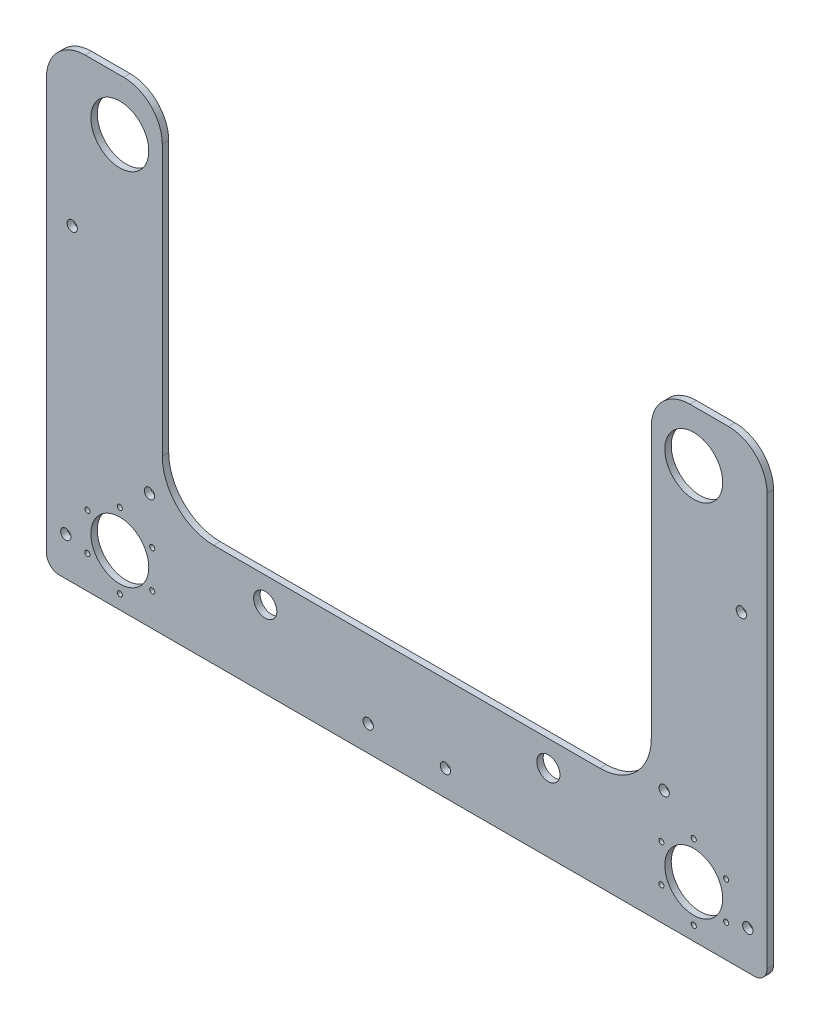
from build123d import *

# Parameters (mm, degrees)
SKETCH1_R           = 14.2875
SKETCH1_R_2         = 1.27
SKETCH1_R_3         = 5.715
SKETCH1_R_4         = 2.54
BOSS_EXTRUDE3_DEPTH = 3.175
SKETCH2_W           = 355.6
SKETCH2_H           = 19.05
CUT_EXTRUDE1_DEPTH  = 290.621961572
FILLET1_R           = 19.05


with BuildPart() as part:
    # Sketch1 → Boss-Extrude3 (new body)
    with BuildSketch(Plane.XY):
        with BuildLine():
            Line((120.65, -152.4), (120.65, -6.35))
            Line((120.65, -6.35), (120.65, 6.35))
            ThreePointArc((120.65, 6.35), (124.369743879, 15.330256121), (133.35, 19.05))
            Line((133.35, 19.05), (165.1, 19.05))
            ThreePointArc((165.1, 19.05), (174.080256121, 15.330256121), (177.8, 6.35))
            Line((177.8, 6.35), (177.8, -6.35))
            Line((177.8, -6.35), (177.8, -222.25))
            ThreePointArc((177.8, -222.25), (175.940128061, -226.740128061), (171.45, -228.6))
            Line((171.45, -228.6), (12.7, -228.6))
            Line((12.7, -228.6), (-12.7, -228.6))
            Line((-12.7, -228.6), (-171.45, -228.6))
            ThreePointArc((-171.45, -228.6), (-175.940128061, -226.740128061), (-177.8, -222.25))
            Line((-177.8, -222.25), (-177.8, -6.35))
            Line((-177.8, -6.35), (-177.8, 6.35))
            ThreePointArc((-177.8, 6.35), (-174.080256121, 15.330256121), (-165.1, 19.05))
            Line((-165.1, 19.05), (-133.35, 19.05))
            ThreePointArc((-133.35, 19.05), (-124.369743879, 15.330256121), (-120.65, 6.35))
            Line((-120.65, 6.35), (-120.65, -6.35))
            Line((-120.65, -6.35), (-120.65, -152.4))
            ThreePointArc((-120.65, -152.4), (-113.210512242, -170.360512242), (-95.25, -177.8))
            Line((-95.25, -177.8), (-12.7, -177.8))
            Line((-12.7, -177.8), (12.7, -177.8))
            Line((12.7, -177.8), (95.25, -177.8))
            ThreePointArc((95.25, -177.8), (113.210512242, -170.360512242), (120.65, -152.4))
        make_face()
        with Locations((141.605, -25.4)):
            Circle(SKETCH1_R, mode=Mode.SUBTRACT)
        with Locations((-141.605, -25.4)):
            Circle(SKETCH1_R, mode=Mode.SUBTRACT)
        with Locations((-141.605, -203.2)):
            Circle(SKETCH1_R, mode=Mode.SUBTRACT)
        with Locations((-141.605, -184.722481985)):
            Circle(SKETCH1_R_2, mode=Mode.SUBTRACT)
        with Locations((-125.603, -193.961240992)):
            Circle(SKETCH1_R_2, mode=Mode.SUBTRACT)
        with Locations((-125.603, -212.438759008)):
            Circle(SKETCH1_R_2, mode=Mode.SUBTRACT)
        with Locations((-141.605, -221.677518015)):
            Circle(SKETCH1_R_2, mode=Mode.SUBTRACT)
        with Locations((-157.607, -212.438759008)):
            Circle(SKETCH1_R_2, mode=Mode.SUBTRACT)
        with Locations((-157.607, -193.961240992)):
            Circle(SKETCH1_R_2, mode=Mode.SUBTRACT)
        with Locations((157.607, -212.438759008)):
            Circle(SKETCH1_R_2, mode=Mode.SUBTRACT)
        with Locations((157.607, -193.961240992)):
            Circle(SKETCH1_R_2, mode=Mode.SUBTRACT)
        with Locations((141.605, -184.722481985)):
            Circle(SKETCH1_R_2, mode=Mode.SUBTRACT)
        with Locations((125.603, -193.961240992)):
            Circle(SKETCH1_R_2, mode=Mode.SUBTRACT)
        with Locations((125.603, -212.438759008)):
            Circle(SKETCH1_R_2, mode=Mode.SUBTRACT)
        with Locations((141.605, -221.677518015)):
            Circle(SKETCH1_R_2, mode=Mode.SUBTRACT)
        with Locations((141.605, -203.2)):
            Circle(SKETCH1_R, mode=Mode.SUBTRACT)
        with Locations((-69.85, -190.5)):
            Circle(SKETCH1_R_3, mode=Mode.SUBTRACT)
        with Locations((69.85, -190.5)):
            Circle(SKETCH1_R_3, mode=Mode.SUBTRACT)
        with Locations((-19.05, -215.9)):
            Circle(SKETCH1_R_4, mode=Mode.SUBTRACT)
        with Locations((-127, -171.45)):
            Circle(SKETCH1_R_4, mode=Mode.SUBTRACT)
        with Locations((-149.225, 6.35)):
            Circle(SKETCH1_R_4, mode=Mode.SUBTRACT)
        with Locations((127, -171.45)):
            Circle(SKETCH1_R_4, mode=Mode.SUBTRACT)
        with Locations((149.225, 6.35)):
            Circle(SKETCH1_R_4, mode=Mode.SUBTRACT)
        with Locations((-168.275, -209.55)):
            Circle(SKETCH1_R_4, mode=Mode.SUBTRACT)
        with Locations((168.275, -209.55)):
            Circle(SKETCH1_R_4, mode=Mode.SUBTRACT)
        with Locations((-165.1, -76.2)):
            Circle(SKETCH1_R_4, mode=Mode.SUBTRACT)
        with Locations((165.1, -76.2)):
            Circle(SKETCH1_R_4, mode=Mode.SUBTRACT)
        with Locations((19.05, -215.9)):
            Circle(SKETCH1_R_4, mode=Mode.SUBTRACT)
    extrude(amount=BOSS_EXTRUDE3_DEPTH)

    # Sketch2 → Cut-Extrude1 (cut, through all)
    with BuildSketch(Plane.XY.offset(3.175)):
        with Locations((0, 9.525)):
            Rectangle(SKETCH2_W, SKETCH2_H)
    extrude(amount=-CUT_EXTRUDE1_DEPTH, mode=Mode.SUBTRACT)

    # Fillet1
    fillet1_edges = [part.edges().sort_by_distance(p)[0] for p in [
        (177.8, 0, 1.5875),
        (120.65, 0, 1.5875),
        (-120.65, 0, 1.5875),
        (-177.8, 0, 1.5875),
    ]]
    fillet(fillet1_edges, radius=FILLET1_R)


solid = part.part
